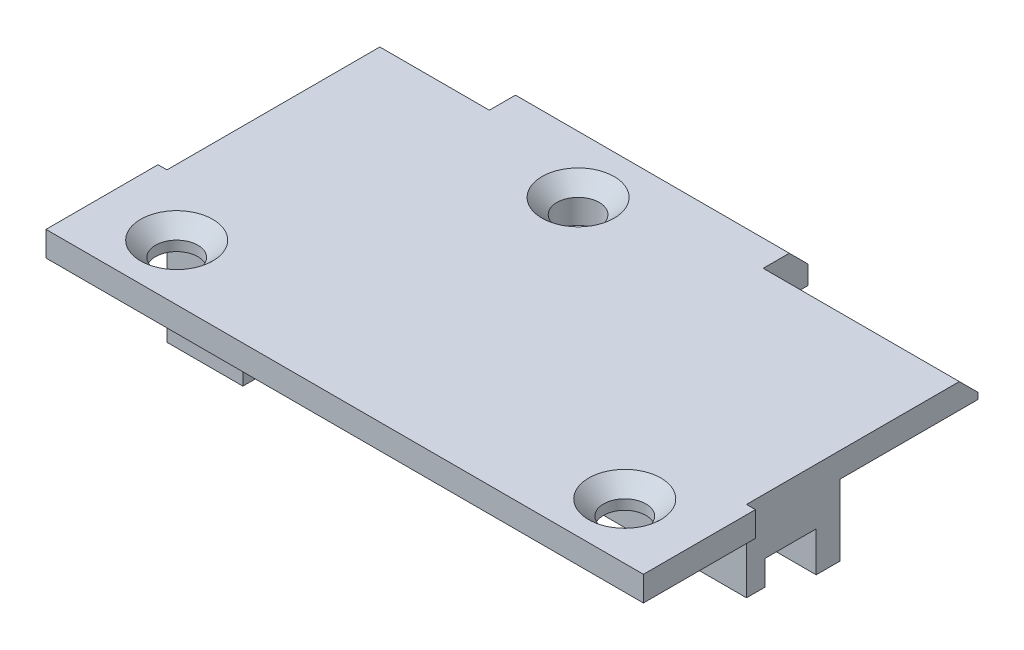
from build123d import *

# Parameters (mm, degrees)
SKETCH1_R           = 1.7
BOSS_EXTRUDE1_DEPTH = 2
CHAMFER1_SIZE       = 1.5
CHAMFER2_SIZE       = 1.2
SKETCH2_W           = 22
SKETCH2_H           = 2.1
BOSS_EXTRUDE2_DEPTH = 1
SKETCH3_W           = 14.56
SKETCH3_H           = 8
SKETCH3_R           = 1.7
BOSS_EXTRUDE3_DEPTH = 1.15
BOSS_EXTRUDE4_DEPTH = 5.7
FILLET1_R           = 0.5
SKETCH5_W           = 6.1
SKETCH5_H           = 5.6
BOSS_EXTRUDE5_DEPTH = 4.3
SKETCH6_W           = 40.46
SKETCH6_H           = 5.6
CUT_EXTRUDE1_DEPTH  = 1.2
CUT_EXTRUDE2_DEPTH  = 2


with BuildPart() as part:
    # Sketch1 → Boss-Extrude1 (new body)
    with BuildSketch(Plane(origin=(0, 0, 0), x_dir=(1, 0, 0), z_dir=(0, 1, 0))):
        Polygon((0, 0), (0, 9), (0.72, 9), (0.72, 27.6), (9.52, 27.6), (9.52, 29.7), (31.52, 29.7), (31.52, 27.6), (47.28, 27.6), (47.28, 9), (48, 9), (48, 0), align=None)
        with Locations((19.15, 23.6)):
            Circle(SKETCH1_R, mode=Mode.SUBTRACT)
        with Locations((6, 4.5)):
            Circle(SKETCH1_R, mode=Mode.SUBTRACT)
        with Locations((42, 4.5)):
            Circle(SKETCH1_R, mode=Mode.SUBTRACT)
    extrude(amount=-BOSS_EXTRUDE1_DEPTH)

    # Chamfer1
    chamfer1_edges = [part.edges().sort_by_distance(p)[0] for p in [
        (5.12, 0, -27.6),
        (20.52, 0, -29.7),
        (39.4, 0, -27.6),
    ]]
    chamfer(chamfer1_edges, length=CHAMFER1_SIZE)

    # Chamfer2
    chamfer2_edges = [part.edges().sort_by_distance(p)[0] for p in [
        (4.3, 0, -4.5),
        (17.45, 0, -23.6),
        (40.3, 0, -4.5),
    ]]
    chamfer(chamfer2_edges, length=CHAMFER2_SIZE)

    # Sketch2 → Boss-Extrude2 (add)
    with BuildSketch(Plane.XZ.offset(2)):
        with Locations((20.52, -28.65)):
            Rectangle(SKETCH2_W, SKETCH2_H)
    extrude(amount=BOSS_EXTRUDE2_DEPTH)

    # Sketch3 → Boss-Extrude3 (add)
    with BuildSketch(Plane.XZ.offset(2)):
        with Locations((19, -23.6)):
            Rectangle(SKETCH3_W, SKETCH3_H)
        with Locations((19.15, -23.6)):
            Circle(SKETCH3_R, mode=Mode.SUBTRACT)
    extrude(amount=BOSS_EXTRUDE3_DEPTH)

    # Sketch4 → Boss-Extrude4 (add)
    with BuildSketch(Plane.XZ.offset(2)):
        Polygon((0.72, -9), (47.28, -9), (47.28, -16.5), (44.18, -16.5), (44.18, -18.4), (42.26, -18.4), (42.26, -16.5), (38.56, -16.5), (38.56, -18.4), (35.18, -18.4), (35.18, -16.5), (31.48, -16.5), (31.48, -18.4), (30.09, -18.4), (30.09, -14.6), (26.6, -14.6), (26.6, -13.6), (11.4, -13.6), (11.4, -18.4), (10.02, -18.4), (10.02, -16.5), (6.32, -16.5), (6.32, -18.4), (3.72, -18.4), (3.72, -19.6), (0.72, -19.6), align=None)
    extrude(amount=BOSS_EXTRUDE4_DEPTH)

    # Fillet1
    fillet1_edges = [part.edges().sort_by_distance(p)[0] for p in [
        (42.26, -4.85, -18.4),
        (42.26, -4.85, -16.5),
        (35.18, -4.85, -18.4),
        (35.18, -4.85, -16.5),
        (38.56, -4.85, -16.5),
        (38.56, -4.85, -18.4),
        (31.48, -4.85, -16.5),
        (31.48, -4.85, -18.4),
        (10.02, -4.85, -18.4),
        (10.02, -4.85, -16.5),
        (6.32, -4.85, -16.5),
        (6.32, -4.85, -18.4),
    ]]
    fillet(fillet1_edges, radius=FILLET1_R)

    # Sketch5 → Boss-Extrude5 (add)
    with BuildSketch(Plane.XZ.offset(7.7)):
        with Locations((3.77, -11.8)):
            Rectangle(SKETCH5_W, SKETCH5_H)
    extrude(amount=BOSS_EXTRUDE5_DEPTH)

    # Sketch6 → Cut-Extrude1 (cut)
    with BuildSketch(Plane.XZ.offset(7.7)):
        with Locations((27.05, -11.8)):
            Rectangle(SKETCH6_W, SKETCH6_H)
    extrude(amount=-CUT_EXTRUDE1_DEPTH, mode=Mode.SUBTRACT)

    # Sketch7 → Cut-Extrude2 (cut)
    with BuildSketch(Plane.XZ.offset(6.5)):
        with BuildLine():
            Line((11.4, -13.6), (11.4, -13.32))
            ThreePointArc((11.4, -13.32), (11.60493511, -12.709074208), (12.14, -12.35))
            Line((12.14, -12.35), (14.52, -11.689318534))
            ThreePointArc((14.52, -11.689318534), (19.040764124, -10.793788493), (23.64, -10.5))
            Line((23.64, -10.5), (47.28, -10.5))
            Line((47.28, -10.5), (47.28, -14.6))
            Line((47.28, -14.6), (26.6, -14.6))
            Line((26.6, -14.6), (26.6, -13.6))
            Line((26.6, -13.6), (11.4, -13.6))
        make_face()
    extrude(amount=-CUT_EXTRUDE2_DEPTH, mode=Mode.SUBTRACT)


solid = part.part
